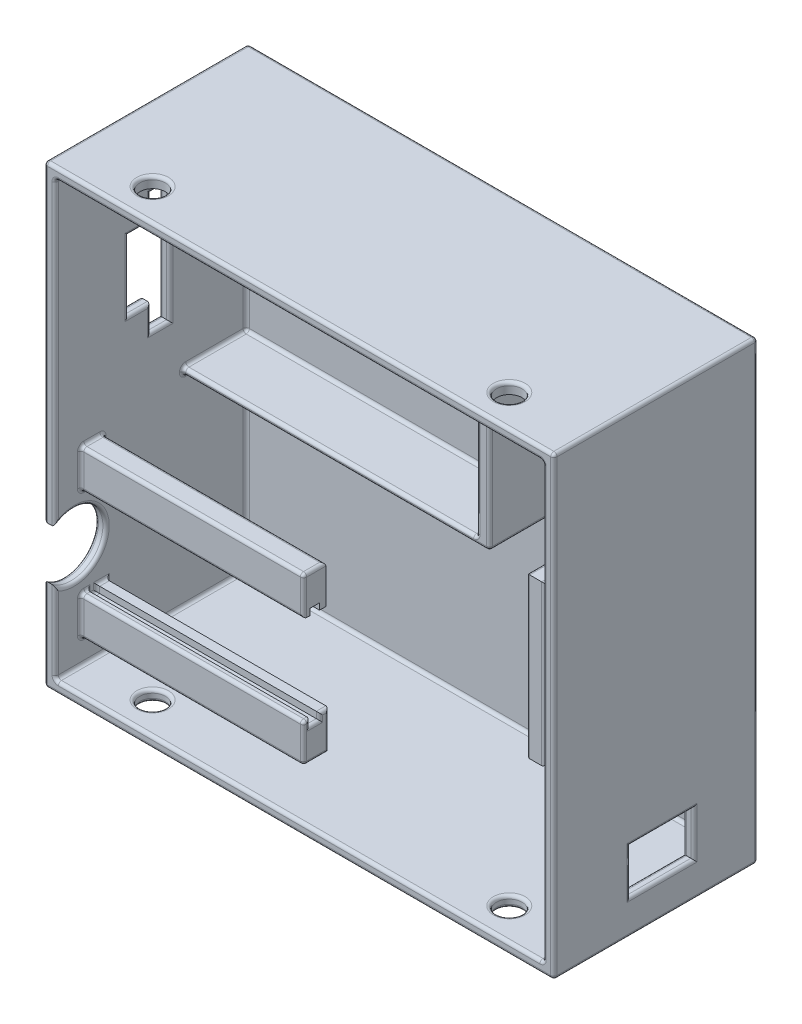
from build123d import *

# Parameters (mm, degrees)
ESQUISSE1_W               = 80
ESQUISSE1_H               = 71.5
BOSS_EXTRU_1_DEPTH        = 2
ESQUISSE2_W               = 80
ESQUISSE2_H               = 71.5
ESQUISSE2_W_2             = 76.6
ESQUISSE2_H_2             = 68.1
BOSS_EXTRU_2_DEPTH        = 30
BOSS_EXTRU_3_DEPTH        = 10
ESQUISSE4_W               = 2.891674157
ESQUISSE4_H               = 25
BOSS_EXTRU_4_DEPTH        = 10
ENL_V_MAT_EXTRU_1_DEPTH   = 10
ESQUISSE6_W               = 10
ESQUISSE6_H               = 7
ENL_V_MAT_EXTRU_2_DEPTH   = 10
BOSS_EXTRU_5_DEPTH        = 35
ESQUISSE8_R               = 5
ENL_V_MAT_EXTRU_3_DEPTH   = 35
ESQUISSE10_R              = 2
ENL_V_MAT_EXTRU_4_DEPTH   = 5
SYM_TRIE2_COPY_1_SKETCH_R = 2
SYM_TRIE2_COPY_1_DEPTH    = 5
CONG_1_R                  = 0.5


with BuildPart() as part:
    # Esquisse1 → Boss.-Extru.1 (new body)
    with BuildSketch(Plane.XY):
        Rectangle(ESQUISSE1_W, ESQUISSE1_H)
    extrude(amount=BOSS_EXTRU_1_DEPTH)

    # Esquisse2 → Boss.-Extru.2 (add)
    with BuildSketch(Plane.XY.offset(2)):
        Rectangle(ESQUISSE2_W, ESQUISSE2_H)
        Rectangle(ESQUISSE2_W_2, ESQUISSE2_H_2, mode=Mode.SUBTRACT)
    extrude(amount=BOSS_EXTRU_2_DEPTH)

    # Esquisse3 → Boss.-Extru.3 (add)
    with BuildSketch(Plane.XY.offset(2)):
        Polygon((-38.3, -2.45), (9.9, -2.45), (9.9, 34.05), (7.9, 34.05), (7.9, -1.45), (-38.3, -1.45), align=None)
    extrude(amount=BOSS_EXTRU_3_DEPTH)

    # Esquisse4 → Boss.-Extru.4 (add)
    with BuildSketch(Plane.XY.offset(2)):
        with Locations((17.145837079, -14.95)):
            Rectangle(ESQUISSE4_W, ESQUISSE4_H)
    extrude(amount=BOSS_EXTRU_4_DEPTH)

    # Esquisse5 → Enlèv. mat.-Extru.1 (cut)
    with BuildSketch(Plane.ZY.offset(40)):
        Polygon((14, 24.75), (14, 5.75), (17, 5.75), (17, 9.75), (20.5, 9.75), (20.5, 20.75), (17, 20.75), (17, 24.75), align=None)
    extrude(amount=-ENL_V_MAT_EXTRU_1_DEPTH, mode=Mode.SUBTRACT)

    # Esquisse6 → Enlèv. mat.-Extru.2 (cut)
    with BuildSketch(Plane(origin=(40, 0, 0), x_dir=(0, 0, -1), z_dir=(1, 0, 0))):
        with Locations((-15, -26.832186434)):
            Rectangle(ESQUISSE6_W, ESQUISSE6_H)
    extrude(amount=-ENL_V_MAT_EXTRU_2_DEPTH, mode=Mode.SUBTRACT)

    # Esquisse7 → Boss.-Extru.5 (add)
    with BuildSketch(Plane(origin=(-38.3, 0, 0), x_dir=(0, 0, -1), z_dir=(1, 0, 0))):
        Polygon((-27.999960179, -10.249991344), (-27.999960179, -4.25), (-24.5, -4.25), (-24.5, -10.258924187), (-25.499960179, -10.25), (-25.499960179, -9.25), (-26.999960179, -9.25), (-26.999960179, -10.25), align=None)
        Polygon((-27.999960179, -24.249991344), (-27.999960179, -30.249991344), (-23.999960179, -30.249991344), (-23.999960179, -24.249991344), (-25.499960179, -24.249991344), (-25.499960179, -25.25), (-26.999960179, -25.25), (-26.999960179, -24.249991344), align=None)
    extrude(amount=BOSS_EXTRU_5_DEPTH)

    # Esquisse8 → Enlèv. mat.-Extru.3 (cut)
    with BuildSketch(Plane.ZY.offset(40)):
        with Locations((28.999960179, -17.249991344)):
            Circle(ESQUISSE8_R)
    extrude(amount=-ENL_V_MAT_EXTRU_3_DEPTH, mode=Mode.SUBTRACT)

    # Esquisse10 → Enlèv. mat.-Extru.4 (cut)
    with BuildSketch(Plane.XZ.offset(35.75)):
        with Locations(Location((-28, 26.999960179, 0), (0, 0, 270))):
            Circle(ESQUISSE10_R)
    enl_v_mat_extru_4 = extrude(amount=-ENL_V_MAT_EXTRU_4_DEPTH, mode=Mode.SUBTRACT)

    # Symétrie1: Enlèv. mat.-Extru.4 across plane
    add(enl_v_mat_extru_4.mirror(Plane(origin=(0, 0, 0), x_dir=(0, 0, 1), z_dir=(1, 0, 0))), mode=Mode.SUBTRACT)

    # Symétrie2: Enlèv. mat.-Extru.4 across plane
    add(enl_v_mat_extru_4.mirror(Plane.ZX), mode=Mode.SUBTRACT)

    # Symétrie2 copy 1 sketch → Symétrie2 copy 1 (cut)
    with BuildSketch(Plane(origin=(0, 35.75, 0), x_dir=(-1, 0, 0), z_dir=(0, 1, 0))):
        with Locations(Location((-28, 26.999960179, 0), (0, 0, 270))):
            Circle(SYM_TRIE2_COPY_1_SKETCH_R)
    extrude(amount=-SYM_TRIE2_COPY_1_DEPTH, mode=Mode.SUBTRACT)

    # Congé1
    cong_1_edges = [part.edges().sort_by_distance(p)[0] for p in [
        (-40, 35.75, 16),
        (0, 35.75, 0),
        (0, 35.75, 32),
        (40, 35.75, 16),
        (-28, 35.75, 28.999960179),
        (28, 35.75, 28.999960179),
        (-40, 0, 0),
        (-40, 11.249989395, 32),
        (-40, -17.249991344, 23.999960179),
        (-40, -28.499980739, 32),
        (-40, -35.75, 16),
        (-40, 15.25, 14),
        (-40, 24.75, 15.5),
        (-40, 5.75, 15.5),
        (-40, 22.75, 17),
        (-40, 7.75, 17),
        (-40, 20.75, 18.75),
        (-40, 9.75, 18.75),
        (-40, 15.25, 20.5),
        (40, 0, 0),
        (0, -35.75, 0),
        (-38.3, 10.399989395, 32),
        (0, 34.05, 32),
        (38.3, 0, 32),
        (0, -34.05, 32),
        (-38.3, -27.649980739, 32),
        (0, -35.75, 32),
        (40, 0, 32),
        (40, -35.75, 16),
        (40, -26.832186434, 20),
        (40, -30.332186434, 15),
        (40, -26.832186434, 10),
        (40, -23.332186434, 15),
        (-38.3, -17.249991344, 23.999960179),
        (28, -35.75, 28.999960179),
        (-28, -35.75, 28.999960179),
        (-38.3, 15.25, 14),
        (-38.3, 24.75, 15.5),
        (-38.3, 5.75, 15.5),
        (-38.3, 22.75, 17),
        (-38.3, 7.75, 17),
        (-38.3, 20.75, 18.75),
        (-38.3, 9.75, 18.75),
        (-38.3, 15.25, 20.5),
        (-38.3, -18.25, 2),
        (-38.3, -2.45, 7),
        (-38.3, -1.95, 12),
        (-38.3, -1.45, 7),
        (-38.3, 16.3, 2),
        (-38.3, 34.05, 17),
        (-38.3, -34.05, 17),
        (-38.3, -24.249991344, 27.499960179),
        (-38.3, -24.749995672, 26.999960179),
        (-38.3, -27.249991344, 27.999960179),
        (-38.3, -25.25, 26.249960179),
        (-38.3, -30.249991344, 25.999960179),
        (-38.3, -24.749995672, 25.499960179),
        (-38.3, -27.249991344, 23.999960179),
        (-38.3, -24.249991344, 24.749960179),
        (-38.3, -7.249995672, 27.999960179),
        (-38.3, -10.249995672, 27.499960179),
        (-38.3, -4.25, 26.249980089),
        (-38.3, -9.75, 26.999960179),
        (-38.3, -7.254462094, 24.5),
        (-38.3, -9.25, 26.249960179),
        (-38.3, -10.254462094, 24.999980089),
        (-38.3, -9.75, 25.499960179),
        (7.9, 34.05, 7),
        (8.9, 34.05, 12),
        (38.3, 34.05, 17),
        (9.9, 34.05, 7),
        (38.3, 0, 2),
        (38.3, -34.05, 17),
        (38.3, -26.832186434, 20),
        (38.3, -30.332186434, 15),
        (38.3, -26.832186434, 10),
        (38.3, -23.332186434, 15),
        (0, -34.05, 2),
        (28, -34.05, 28.999960179),
        (-28, -34.05, 28.999960179),
        (9.9, 15.8, 2),
        (-14.2, -2.45, 2),
        (17.145837079, -2.45, 2),
        (18.591674157, -14.95, 2),
        (17.145837079, -27.45, 2),
        (15.7, -14.95, 2),
        (9.9, -2.45, 7),
        (-14.2, -2.45, 12),
        (9.9, 15.8, 12),
        (7.9, 16.3, 12),
        (-15.2, -1.45, 12),
        (7.9, -1.45, 7),
        (-15.2, -1.45, 2),
        (7.9, 16.3, 2),
        (-20.8, -24.249991344, 27.999960179),
        (-3.3, -24.249991344, 27.499960179),
        (-3.3, -24.749995672, 26.999960179),
        (-20.8, -30.249991344, 27.999960179),
        (-3.3, -27.249991344, 27.999960179),
        (-3.3, -25.25, 26.249960179),
        (-3.3, -30.249991344, 25.999960179),
        (-3.3, -24.749995672, 25.499960179),
        (-3.3, -27.249991344, 23.999960179),
        (-3.3, -24.249991344, 24.749960179),
        (-20.8, -10.249991344, 27.999960179),
        (-20.8, -4.25, 27.999960179),
        (-3.3, -7.249995672, 27.999960179),
        (-20.8, -4.25, 24.5),
        (-3.3, -4.25, 26.249980089),
        (18.591674157, -2.45, 7),
        (15.7, -2.45, 7),
        (18.591674157, -27.45, 7),
        (18.591674157, -14.95, 12),
        (15.7, -27.45, 7),
        (15.7, -14.95, 12),
    ]]
    fillet(cong_1_edges, radius=CONG_1_R - 0.0001)  # a hair under: the kernel refuses the full size


solid = part.part
